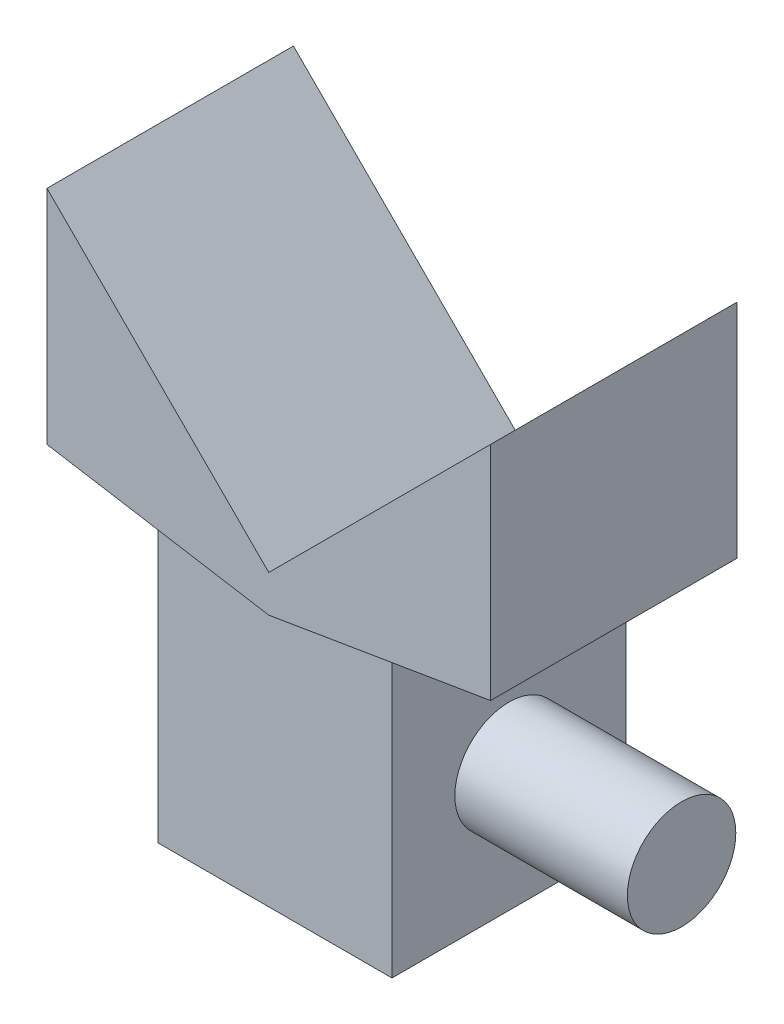
from build123d import *

# Parameters (mm, degrees)
BOSS_EXTRUDE5_DEPTH = 10
BOSS_EXTRUDE6_REACH = 26.94
SKETCH2_W           = 9.5
SKETCH2_H           = 9.5
SKETCH5_R           = 2.2
BOSS_EXTRUDE7_DEPTH = 7


with BuildPart() as part:
    # Sketch1 → Boss-Extrude5 (new body)
    with BuildSketch(Plane.XY):
        Polygon((0, 0), (-9, 9), (-9, 0), (0, -1.5), (9, 0), (9, 9), align=None)
    extrude(amount=BOSS_EXTRUDE5_DEPTH)

    # Sketch2 → Boss-Extrude6 (add, up to next)
    with BuildSketch(Plane(origin=(0, -12, 0), x_dir=(1, 0, 0), z_dir=(0, 1, 0)), mode=Mode.PRIVATE) as boss_extrude6_sk1:
        with Locations((0, -5)):
            Rectangle(SKETCH2_W, SKETCH2_H)
    boss_extrude6_tool1 = extrude(boss_extrude6_sk1.sketch, amount=BOSS_EXTRUDE6_REACH, mode=Mode.PRIVATE) - part.part
    add(boss_extrude6_tool1.solids().sort_by_distance((0, -12, 5))[0])

    # Sketch5 → Boss-Extrude7 (add)
    with BuildSketch(Plane(origin=(4.75, 0, 0), x_dir=(0, 0, -1), z_dir=(1, 0, 0))):
        with Locations((-4.999863211, -6.877630414)):
            Circle(SKETCH5_R)
    extrude(amount=BOSS_EXTRUDE7_DEPTH)


solid = part.part
